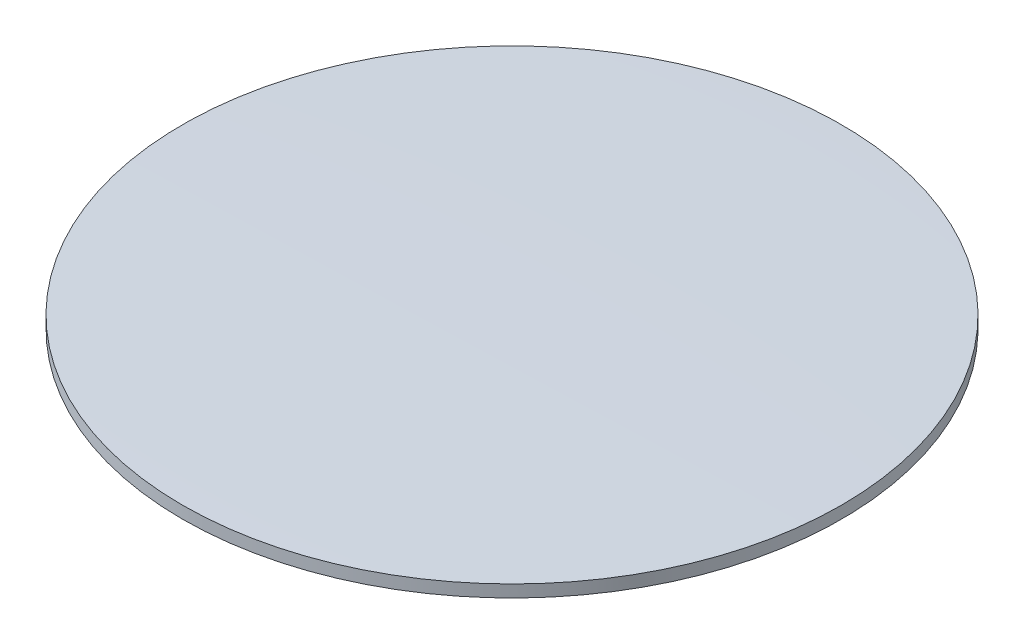
from build123d import *


with BuildPart() as part:
    # Esquisse1 → Révolution1 (revolve)
    with BuildSketch(Plane.XY):
        with BuildLine():
            Line((0, 0), (20.1, 0))
            Line((20.1, 0), (20.1, 0.742361098))
            add(Edge.make_bspline(
                [(20.1, 0.742361098), (11.536070233, 1), (0, 1)],
                knots=[0.836587539, 0.836587539, 0.836587539, 1.570796327, 1.570796327, 1.570796327], degree=2, weights=[1, 0.933370531, 1]))
            Line((0, 1), (0, 0))
        make_face()
    revolve(axis=Axis((0, 1, 0), (0, -1, 0)))


solid = part.part
